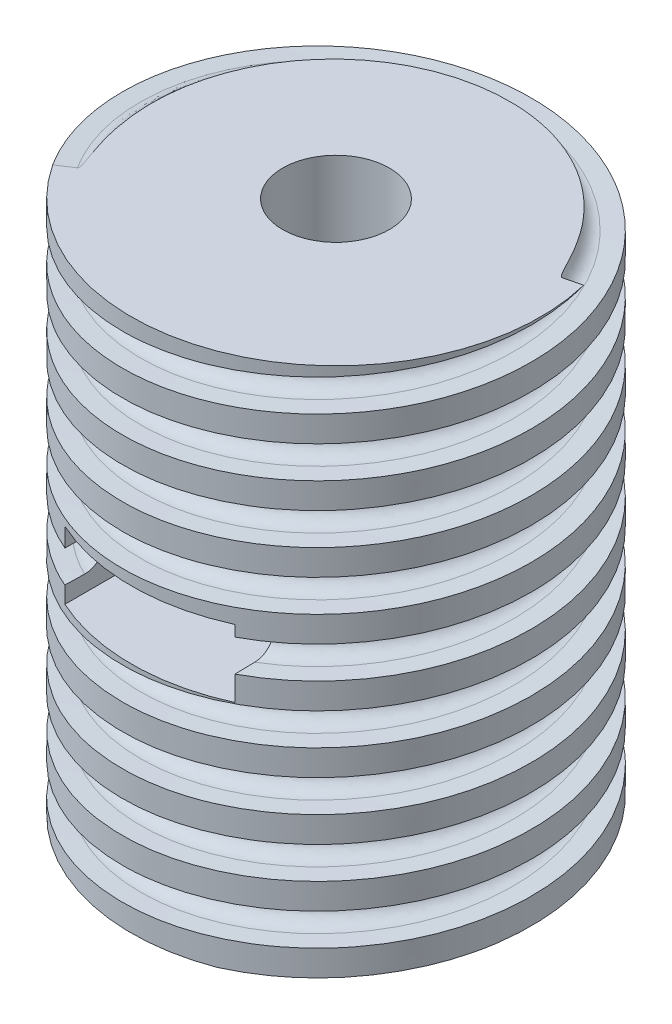
from build123d import *

# Parameters (mm, degrees)
SKETCH1_R           = 11.5
SKETCH1_R_2         = 1.5
BOSS_EXTRUDE1_DEPTH = 30
CUT_SWEEP1_PITCH    = 3.25
SKETCH7_W           = 9.56
SKETCH7_H           = 3.8
CUT_EXTRUDE1_DEPTH  = 6
SKETCH9_R           = 3
CUT_EXTRUDE5_DEPTH  = 25
CUT_EXTRUDE6_REACH  = 38.573
SKETCH8_R           = 1.25


with BuildPart() as part:
    # Sketch1 → Boss-Extrude1 (new body)
    with BuildSketch(Plane(origin=(0, 0, 0), x_dir=(1, 0, 0), z_dir=(0, 1, 0))):
        with Locations(Location((0, 0, 0), (0, 0, 270))):
            Circle(SKETCH1_R)
        with Locations(Location((0, 0, 0), (0, 0, 270))):
            Circle(SKETCH1_R_2, mode=Mode.SUBTRACT)
    extrude(amount=BOSS_EXTRUDE1_DEPTH)

    # Cut-Sweep1: the profile of Sketch3 screwed along a right-hand helix of 20 turns, 12 arcs to a turn; built about Z, then put on its axis
    cut_sweep1_z = Axis((0, 0, 0), (0, 0, 1))
    cut_sweep1_corners = [(10.5, 0, 4), (20.5, 0, 4), (20.5, 0, 2.2), (10.5, 0, 2.2), (9.6, 0, 3.1)]
    with BuildLine(mode=Mode.PRIVATE) as cut_sweep1_profile:
        Line(cut_sweep1_corners[0], cut_sweep1_corners[1])
        Line(cut_sweep1_corners[1], cut_sweep1_corners[2])
        Line(cut_sweep1_corners[2], cut_sweep1_corners[3])
        ThreePointArc((10.5, 0, 2.2), (9.863603897, 0, 2.463603897), (9.6, 0, 3.1))
        ThreePointArc((9.6, 0, 3.1), (9.863603897, 0, 3.736396103), (10.5, 0, 4))
    cut_sweep1_cap = Face(cut_sweep1_profile.wire())
    cut_sweep1_arcs = [((10.5, 0, 2.2), (9.6, 0, 2.2), (9.6, 0, 3.1), (1, 0.7071067811865482, 1)), ((9.6, 0, 3.1), (9.6, 0, 4), (10.5, 0, 4), (1, 0.7071067811865482, 1))]  # start, shoulder, end, weights
    cut_sweep1_turn_angles = [0, 15, 30, 45, 60, 75, 90, 105, 120, 135, 150, 165, 180, 195, 210, 225, 240, 255, 270, 285, 300, 315, 330, 345, 360]
    cut_sweep1_turn_weights = [1, 0.9659258262890683, 1, 0.9659258262890683, 1, 0.9659258262890683, 1, 0.9659258262890683, 1, 0.9659258262890683, 1, 0.9659258262890683, 1, 0.9659258262890683, 1, 0.9659258262890683, 1, 0.9659258262890683, 1, 0.9659258262890683, 1, 0.9659258262890683, 1, 0.9659258262890683, 1]
    cut_sweep1_turn_rails = [Edge.make_bspline([Vector(p[0], p[1], 0).rotate(cut_sweep1_z, cut_sweep1_turn_angles[k]) / cut_sweep1_turn_weights[k] + Vector(0, 0, p[2] + CUT_SWEEP1_PITCH * cut_sweep1_turn_angles[k] / 360) for k in range(25)], [0, 0, 0, 1, 1, 2, 2, 3, 3, 4, 4, 5, 5, 6, 6, 7, 7, 8, 8, 9, 9, 10, 10, 11, 11, 12, 12, 12], 2, cut_sweep1_turn_weights) for p in cut_sweep1_corners]
    cut_sweep1_turn_sides = [*[Face.make_surface_from_curves(cut_sweep1_turn_rails[p[0]], cut_sweep1_turn_rails[p[1]]) for p in [(0, 1), (1, 2), (2, 3)]], *[Face.make_bezier_surface([[Vector(p[j][0], p[j][1], 0).rotate(cut_sweep1_z, cut_sweep1_turn_angles[2 * i + k]) / cut_sweep1_turn_weights[2 * i + k] + Vector(0, 0, p[j][2] + CUT_SWEEP1_PITCH * cut_sweep1_turn_angles[2 * i + k] / 360) for k in range(3)] for j in range(3)], [[p[3][j] * cut_sweep1_turn_weights[2 * i + k] for k in range(3)] for j in range(3)]) for p in cut_sweep1_arcs for i in range(12)]]
    cut_sweep1 = Plane(origin=(0, -5, 0), x_dir=(-1, 0, 0), z_dir=(0, 1, 0)) * Solid(Shell([*[p.moved(Location((0, 0, CUT_SWEEP1_PITCH * i))) for i in range(20) for p in cut_sweep1_turn_sides], cut_sweep1_cap, cut_sweep1_cap.rotate(cut_sweep1_z, 7200).moved(Location((0, 0, CUT_SWEEP1_PITCH * 7200 / 360)))]))
    add(cut_sweep1, mode=Mode.SUBTRACT)

    # Sketch7 → Cut-Extrude1 (cut)
    with BuildSketch(Plane.XY.offset(11.5)):
        with Locations((0, 15)):
            Rectangle(SKETCH7_W, SKETCH7_H)
    extrude(amount=-CUT_EXTRUDE1_DEPTH, mode=Mode.SUBTRACT)

    # Sketch9 → Cut-Extrude5 (cut)
    with BuildSketch(Plane(origin=(0, 30, 0), x_dir=(1, 0, 0), z_dir=(0, 1, 0))):
        with Locations(Location((0, 0, 0), (0, 0, 270))):
            Circle(SKETCH9_R)
    extrude(amount=-CUT_EXTRUDE5_DEPTH, mode=Mode.SUBTRACT)

    # Sketch8 → Cut-Extrude6 (cut, up to next)
    with BuildSketch(Plane.XY.offset(5.5), mode=Mode.PRIVATE) as cut_extrude6_sk1:
        with Locations((-2.75, 15)):
            Circle(SKETCH8_R)
    cut_extrude6_tool1 = extrude(cut_extrude6_sk1.sketch, amount=-CUT_EXTRUDE6_REACH, mode=Mode.PRIVATE) & part.part
    # Sketch8 → Cut-Extrude6 (cut, up to next)
    with BuildSketch(Plane.XY.offset(5.5), mode=Mode.PRIVATE) as cut_extrude6_sk2:
        with Locations((2.75, 15)):
            Circle(SKETCH8_R)
    cut_extrude6_tool2 = extrude(cut_extrude6_sk2.sketch, amount=-CUT_EXTRUDE6_REACH, mode=Mode.PRIVATE) & part.part
    add(cut_extrude6_tool1.solids().sort_by_distance((-2.75, 15, 5.5))[0], mode=Mode.SUBTRACT)
    add(cut_extrude6_tool2.solids().sort_by_distance((2.75, 15, 5.5))[0], mode=Mode.SUBTRACT)


solid = part.part
